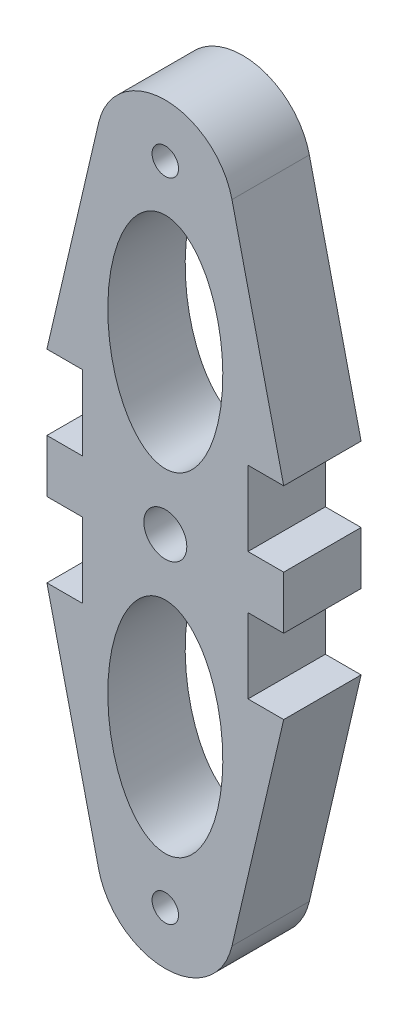
from build123d import *

# Parameters (mm, degrees)
SKETCH1_R           = 1
SKETCH1_R_2         = 1.625
BOSS_EXTRUDE1_DEPTH = 5.85


with BuildPart() as part:
    # Sketch1 → Boss-Extrude1 (new body)
    with BuildSketch(Plane.XY):
        with BuildLine():
            Line((781.409168709, 471.052542), (781.409168709, 465.402542))
            Line((781.409168709, 465.402542), (778.709168709, 465.402542))
            Line((778.709168709, 465.402542), (778.709168709, 461.402176393))
            Line((778.709168709, 461.402176393), (781.409168709, 461.402176393))
            Line((781.409168709, 461.402176393), (781.409168709, 455.752176393))
            Line((781.409168709, 455.752176393), (778.709168709, 455.752176393))
            Line((778.709168709, 455.752176393), (782.620179881, 438.967359197))
            ThreePointArc((782.620179881, 438.967359197), (787.659168709, 434.967516139), (792.698157537, 438.967359197))
            Line((792.698157537, 438.967359197), (796.609168709, 455.752176393))
            Line((796.609168709, 455.752176393), (793.909168709, 455.752176393))
            Line((793.909168709, 455.752176393), (793.909168709, 461.402176393))
            Line((793.909168709, 461.402176393), (796.609168709, 461.402176393))
            Line((796.609168709, 461.402176393), (796.609168709, 465.402542))
            Line((796.609168709, 465.402542), (793.909168709, 465.402542))
            Line((793.909168709, 465.402542), (793.909168709, 471.052542))
            Line((793.909168709, 471.052542), (796.609168709, 471.052542))
            Line((796.609168709, 471.052542), (792.698157537, 487.837359197))
            ThreePointArc((792.698157537, 487.837359197), (787.659168709, 491.837202254), (782.620179881, 487.837359197))
            Line((782.620179881, 487.837359197), (778.709168709, 471.052542))
            Line((778.709168709, 471.052542), (781.409168709, 471.052542))
        make_face()
        with Locations((787.659168709, 438.967359197)):
            Circle(SKETCH1_R, mode=Mode.SUBTRACT)
        with BuildLine():
            add(Edge.make_bspline(
                [(787.659168709, 442.504336798), (795.187523069, 442.504336798), (791.423345889, 454.95745763), (787.659168709, 467.410578462), (783.894991529, 454.95745763), (780.130814348, 442.504336798), (787.659168709, 442.504336798)],
                knots=[0, 0, 0, 2.094395102, 2.094395102, 4.188790205, 4.188790205, 6.283185307, 6.283185307, 6.283185307], degree=2, weights=[1, 0.5, 1, 0.5, 1, 0.5, 1]))
        make_face(mode=Mode.SUBTRACT)
        with Locations((787.659168709, 463.402359197)):
            Circle(SKETCH1_R_2, mode=Mode.SUBTRACT)
        with Locations((787.659168709, 487.837359197)):
            Circle(SKETCH1_R, mode=Mode.SUBTRACT)
        with BuildLine():
            add(Edge.make_bspline(
                [(787.659168709, 467.696220486), (795.187523069, 467.696220486), (791.423345889, 480.149341318), (787.659168709, 492.60246215), (783.894991529, 480.149341318), (780.130814348, 467.696220486), (787.659168709, 467.696220486)],
                knots=[0, 0, 0, 2.094395102, 2.094395102, 4.188790205, 4.188790205, 6.283185307, 6.283185307, 6.283185307], degree=2, weights=[1, 0.5, 1, 0.5, 1, 0.5, 1]))
        make_face(mode=Mode.SUBTRACT)
    extrude(amount=BOSS_EXTRUDE1_DEPTH)


solid = part.part
